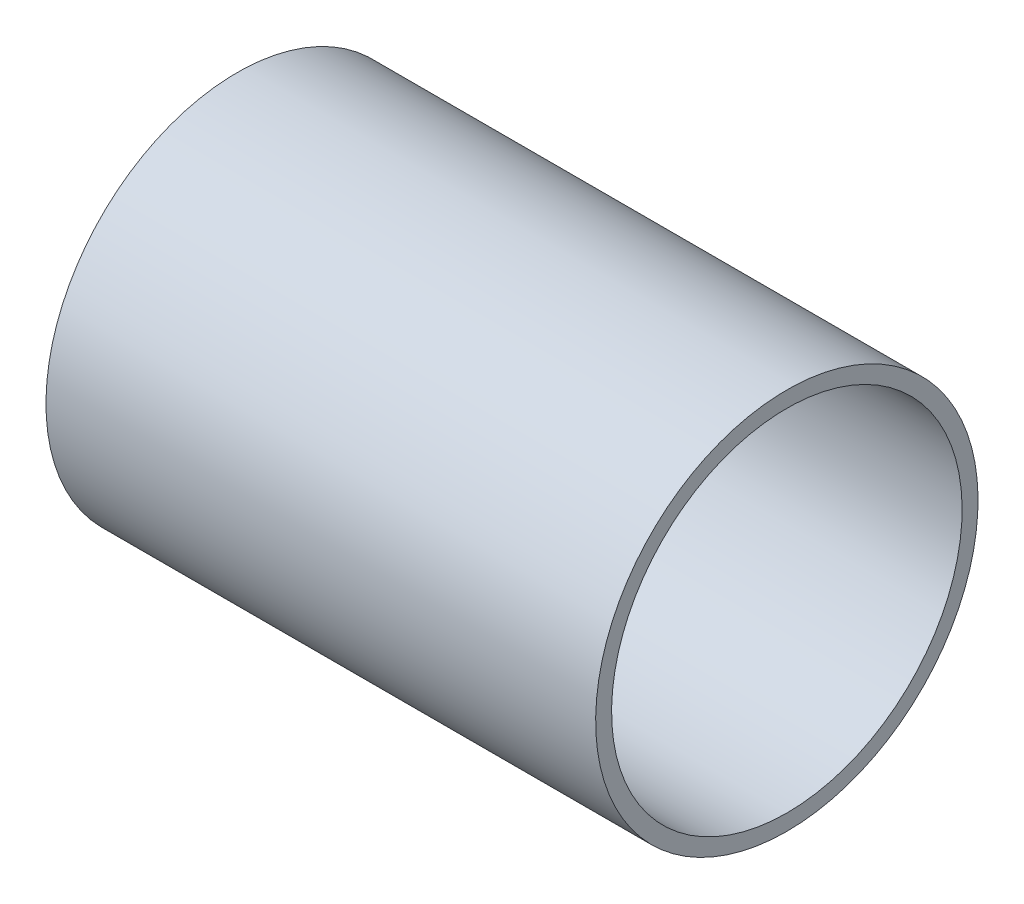
from build123d import *

# Parameters (mm, degrees)
SKETCH1_W = 34.5
SKETCH1_H = 1


with BuildPart() as part:
    # Sketch1 → Revolve1 (revolve)
    with BuildSketch(Plane.XY):
        with Locations((0, 11.5)):
            Rectangle(SKETCH1_W, SKETCH1_H)
    revolve(axis=Axis((-66.577474403, 0, 0), (1, 0, 0)))


solid = part.part
